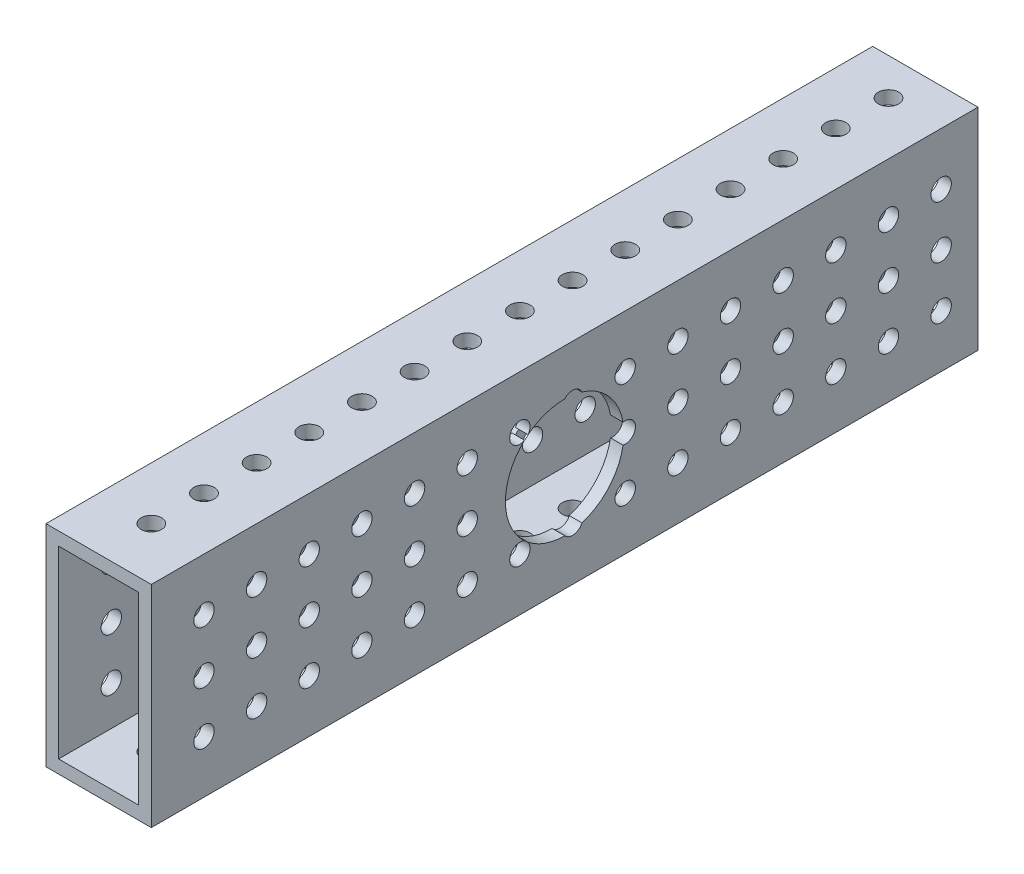
from build123d import *

# Parameters (mm, degrees)
SKETCH1_W             = 25.4
SKETCH1_H             = 50.8
SKETCH1_W_2           = 19.304
SKETCH1_H_2           = 44.45
BOSS_EXTRUDE1_DEPTH   = 99.695
SKETCH2_W             = 2.45745
SKETCH2_H             = 50.8
SKETCH2_AT_POINT_2_W  = 2.45745
SKETCH2_AT_POINT_2_H  = 50.8
SKETCH2_AT_POINT_3_W  = 2.45745
SKETCH2_AT_POINT_3_H  = 50.8
SKETCH2_AT_POINT_4_W  = 2.45745
SKETCH2_AT_POINT_4_H  = 50.8
LPATTERN1_START       = -12.7
LPATTERN1_OUTLINE_R   = 2.45745
LPATTERN1_DEPTH       = 25.4
LPATTERN1_START_2     = -25.4
LPATTERN1_2_OUTLINE_R = 2.45745
LPATTERN1_2_DEPTH     = 50.8
SKETCH3_R             = 14.2875
CUT_EXTRUDE1_DEPTH    = 106.968924808


# Read off the part's stored shape, not the designer's step: LPattern1
with BuildPart() as part:
    # Sketch1 → Boss-Extrude1 (new, symmetric)
    with BuildSketch(Plane.XY):
        Rectangle(SKETCH1_W, SKETCH1_H)
        Rectangle(SKETCH1_W_2, SKETCH1_H_2, mode=Mode.SUBTRACT)
    extrude(amount=BOSS_EXTRUDE1_DEPTH, both=True)

    # Sketch2 → #10 (0.1935) Diameter Hole1 (revolve, cut)
    with BuildSketch(Plane(origin=(0, 25.4, 86.995), x_dir=(0, 0, 1), z_dir=(1, 0, 0))):
        with Locations((1.228725, 25.4)):
            Rectangle(SKETCH2_W, SKETCH2_H)
    revolve(axis=Axis((0, 31.75, 86.995), (0, -1, 0)), mode=Mode.SUBTRACT)

    # Sketch2 at point 2 (carried to point 2, square into its face) → #10 (0.1935) Diameter Hole1 at 2 (revolve, cut)
    with BuildSketch(Plane(origin=(12.7, 12.7, 86.995), x_dir=(0, 0, 1), z_dir=(0, -1, 0))):
        with Locations((1.228725, 25.4)):
            Rectangle(SKETCH2_AT_POINT_2_W, SKETCH2_AT_POINT_2_H)
    revolve(axis=Axis((19.05, 12.7, 86.995), (-1, 0, 0)), mode=Mode.SUBTRACT)

    # Sketch2 at point 3 (carried to point 3, square into its face) → #10 (0.1935) Diameter Hole1 at 3 (revolve, cut)
    with BuildSketch(Plane(origin=(12.7, 0, 86.995), x_dir=(0, 0, 1), z_dir=(0, -1, 0))):
        with Locations((1.228725, 25.4)):
            Rectangle(SKETCH2_AT_POINT_3_W, SKETCH2_AT_POINT_3_H)
    revolve(axis=Axis((19.05, 0, 86.995), (-1, 0, 0)), mode=Mode.SUBTRACT)

    # Sketch2 at point 4 (carried to point 4, square into its face) → #10 (0.1935) Diameter Hole1 at 4 (revolve, cut)
    with BuildSketch(Plane(origin=(12.7, -12.7, 86.995), x_dir=(0, 0, 1), z_dir=(0, -1, 0))):
        with Locations((1.228725, 25.4)):
            Rectangle(SKETCH2_AT_POINT_4_W, SKETCH2_AT_POINT_4_H)
    revolve(axis=Axis((19.05, -12.7, 86.995), (-1, 0, 0)), mode=Mode.SUBTRACT)

    # LPattern1 outline → LPattern1 (cut)
    with BuildSketch(Plane.YZ.offset(LPATTERN1_START)):
        with Locations((-12.7, 74.295)):
            Circle(LPATTERN1_OUTLINE_R)
        with Locations((0, 74.295)):
            Circle(LPATTERN1_OUTLINE_R)
        with Locations((12.7, 74.295)):
            Circle(LPATTERN1_OUTLINE_R)
        with Locations((-12.7, 61.595)):
            Circle(LPATTERN1_OUTLINE_R)
        with Locations((0, 61.595)):
            Circle(LPATTERN1_OUTLINE_R)
        with Locations((12.7, 61.595)):
            Circle(LPATTERN1_OUTLINE_R)
        with Locations((-12.7, 48.895)):
            Circle(LPATTERN1_OUTLINE_R)
        with Locations((0, 48.895)):
            Circle(LPATTERN1_OUTLINE_R)
        with Locations((12.7, 48.895)):
            Circle(LPATTERN1_OUTLINE_R)
        with Locations((-12.7, 36.195)):
            Circle(LPATTERN1_OUTLINE_R)
        with Locations((0, 36.195)):
            Circle(LPATTERN1_OUTLINE_R)
        with Locations((12.7, 36.195)):
            Circle(LPATTERN1_OUTLINE_R)
        with Locations((-12.7, 23.495)):
            Circle(LPATTERN1_OUTLINE_R)
        with Locations((0, 23.495)):
            Circle(LPATTERN1_OUTLINE_R)
        with Locations((12.7, 23.495)):
            Circle(LPATTERN1_OUTLINE_R)
        with Locations((-12.7, 10.795)):
            Circle(LPATTERN1_OUTLINE_R)
        with Locations((0, 10.795)):
            Circle(LPATTERN1_OUTLINE_R)
        with Locations((12.7, 10.795)):
            Circle(LPATTERN1_OUTLINE_R)
        with Locations((-12.7, -1.905)):
            Circle(LPATTERN1_OUTLINE_R)
        with Locations((0, -1.905)):
            Circle(LPATTERN1_OUTLINE_R)
        with Locations((12.7, -1.905)):
            Circle(LPATTERN1_OUTLINE_R)
        with Locations((-12.7, -14.605)):
            Circle(LPATTERN1_OUTLINE_R)
        with Locations((0, -14.605)):
            Circle(LPATTERN1_OUTLINE_R)
        with Locations((12.7, -14.605)):
            Circle(LPATTERN1_OUTLINE_R)
        with Locations((-12.7, -27.305)):
            Circle(LPATTERN1_OUTLINE_R)
        with Locations((0, -27.305)):
            Circle(LPATTERN1_OUTLINE_R)
        with Locations((12.7, -27.305)):
            Circle(LPATTERN1_OUTLINE_R)
        with Locations((-12.7, -40.005)):
            Circle(LPATTERN1_OUTLINE_R)
        with Locations((0, -40.005)):
            Circle(LPATTERN1_OUTLINE_R)
        with Locations((12.7, -40.005)):
            Circle(LPATTERN1_OUTLINE_R)
        with Locations((-12.7, -52.705)):
            Circle(LPATTERN1_OUTLINE_R)
        with Locations((0, -52.705)):
            Circle(LPATTERN1_OUTLINE_R)
        with Locations((12.7, -52.705)):
            Circle(LPATTERN1_OUTLINE_R)
        with Locations((-12.7, -65.405)):
            Circle(LPATTERN1_OUTLINE_R)
        with Locations((0, -65.405)):
            Circle(LPATTERN1_OUTLINE_R)
        with Locations((12.7, -65.405)):
            Circle(LPATTERN1_OUTLINE_R)
        with Locations((-12.7, -78.105)):
            Circle(LPATTERN1_OUTLINE_R)
        with Locations((0, -78.105)):
            Circle(LPATTERN1_OUTLINE_R)
        with Locations((12.7, -78.105)):
            Circle(LPATTERN1_OUTLINE_R)
        with Locations((-12.7, -90.805)):
            Circle(LPATTERN1_OUTLINE_R)
        with Locations((0, -90.805)):
            Circle(LPATTERN1_OUTLINE_R)
        with Locations((12.7, -90.805)):
            Circle(LPATTERN1_OUTLINE_R)
    extrude(amount=LPATTERN1_DEPTH, mode=Mode.SUBTRACT)

    # LPattern1 2 outline → LPattern1 2 (cut)
    with BuildSketch(Plane(origin=(0, 0, 0), x_dir=(1, 0, 0), z_dir=(0, 1, 0)).offset(LPATTERN1_START_2)):
        with Locations((0, -74.295)):
            Circle(LPATTERN1_2_OUTLINE_R)
        with Locations((0, -61.595)):
            Circle(LPATTERN1_2_OUTLINE_R)
        with Locations((0, -48.895)):
            Circle(LPATTERN1_2_OUTLINE_R)
        with Locations((0, -36.195)):
            Circle(LPATTERN1_2_OUTLINE_R)
        with Locations((0, -23.495)):
            Circle(LPATTERN1_2_OUTLINE_R)
        with Locations((0, -10.795)):
            Circle(LPATTERN1_2_OUTLINE_R)
        with Locations((0, 1.905)):
            Circle(LPATTERN1_2_OUTLINE_R)
        with Locations((0, 14.605)):
            Circle(LPATTERN1_2_OUTLINE_R)
        with Locations((0, 27.305)):
            Circle(LPATTERN1_2_OUTLINE_R)
        with Locations((0, 40.005)):
            Circle(LPATTERN1_2_OUTLINE_R)
        with Locations((0, 52.705)):
            Circle(LPATTERN1_2_OUTLINE_R)
        with Locations((0, 65.405)):
            Circle(LPATTERN1_2_OUTLINE_R)
        with Locations((0, 78.105)):
            Circle(LPATTERN1_2_OUTLINE_R)
        with Locations((0, 90.805)):
            Circle(LPATTERN1_2_OUTLINE_R)
    extrude(amount=LPATTERN1_2_DEPTH, mode=Mode.SUBTRACT)

    # Sketch3 → Cut-Extrude1 (cut, through all)
    with BuildSketch(Plane(origin=(12.7, 0, 0), x_dir=(0, 0, -1), z_dir=(1, 0, 0))):
        Circle(SKETCH3_R)
    extrude(amount=-CUT_EXTRUDE1_DEPTH, mode=Mode.SUBTRACT)


solid = part.part
